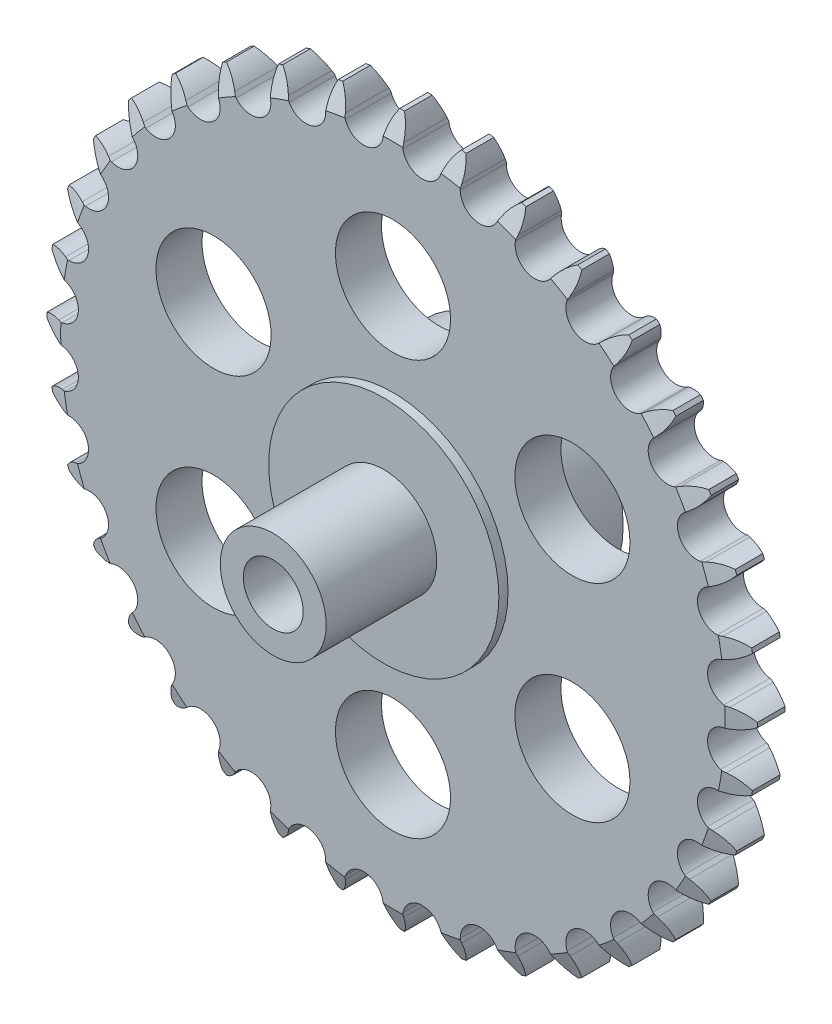
from build123d import *

# Parameters (mm, degrees)
SKETCH2_R                       = 68.60307911
BOSS_EXTRUDE1_DEPTH             = 5
BOSS_EXTRUDE2_REACH             = 99.148
BOSS_EXTRUDE2_DIRECTION_2_REACH = 99.148
CIRPATTERN1_COUNT               = 36
BOSS_EXTRUDE3_DEPTH             = 7
BOSS_EXTRUDE3_DEPTH_BACK        = 20
SKETCH6_R                       = 25
CUT_EXTRUDE1_DEPTH              = 111.942596201
CUT_EXTRUDE1_DEPTH_BACK         = 111.942596201
SKETCH7_R                       = 6.5
SKETCH8_R                       = 11.5
SKETCH8_R_2                     = 6.5
BOSS_EXTRUDE4_DEPTH             = 24
SKETCH9_R                       = 12.5
CUT_EXTRUDE2_DEPTH              = 113.179586609
CIRPATTERN2_COUNT               = 6


with BuildPart() as part:
    # Sketch2 → Boss-Extrude1 (new, symmetric)
    with BuildSketch(Plane.XY):
        Circle(SKETCH2_R)
    extrude(amount=BOSS_EXTRUDE1_DEPTH, both=True)

    # Boss-Extrude2: up to this face of the body (flat: up to its plane)
    boss_extrude2_end = Plane(part.part.faces().sort_by_distance((0, 0, 5))[0])
    # Sketch4 → Boss-Extrude2 (add, up to the picked face)
    with BuildSketch(Plane.XY, mode=Mode.PRIVATE) as boss_extrude2_sk1:
        with BuildLine():
            Line((-0.5, 77.163008044), (0.5, 77.163008044))
            ThreePointArc((0.5, 77.163008044), (1.520836, 75.099924668), (2.042896963, 72.85807911))
            Line((2.042896963, 72.85807911), (2.156832572, 71.85807911))
            ThreePointArc((2.156832572, 71.85807911), (3.469336894, 69.449250243), (5.979152315, 68.342023682))
            ThreePointArc((5.979152315, 68.342023682), (0, 68.60307911), (-5.979152315, 68.342023682))
            ThreePointArc((-5.979152315, 68.342023682), (-3.469336894, 69.449250243), (-2.156832572, 71.85807911))
            Line((-2.156832572, 71.85807911), (-2.042896963, 72.85807911))
            ThreePointArc((-2.042896963, 72.85807911), (-1.520836, 75.099924668), (-0.5, 77.163008044))
        make_face()
    boss_extrude2_tool1 = split(extrude(boss_extrude2_sk1.sketch, amount=BOSS_EXTRUDE2_REACH, mode=Mode.PRIVATE), bisect_by=boss_extrude2_end, keep=Keep.BOTH, mode=Mode.PRIVATE)
    boss_extrude2 = boss_extrude2_tool1.solids().sort_by(Axis((0, 71.819777, 0), (0, 0, 1)))[0]
    add(boss_extrude2)

    # Boss-Extrude2 direction 2: up to this face of the body (flat: up to its plane)
    boss_extrude2_direction_2_end = Plane(part.part.faces().sort_by_distance((0, 0, -5))[0])
    # Sketch4 → Boss-Extrude2 direction 2 (add, up to the picked face)
    with BuildSketch(Plane.XY, mode=Mode.PRIVATE) as boss_extrude2_direction_2_sk1:
        with BuildLine():
            Line((-0.5, 77.163008044), (0.5, 77.163008044))
            ThreePointArc((0.5, 77.163008044), (1.520836, 75.099924668), (2.042896963, 72.85807911))
            Line((2.042896963, 72.85807911), (2.156832572, 71.85807911))
            ThreePointArc((2.156832572, 71.85807911), (3.469336894, 69.449250243), (5.979152315, 68.342023682))
            ThreePointArc((5.979152315, 68.342023682), (0, 68.60307911), (-5.979152315, 68.342023682))
            ThreePointArc((-5.979152315, 68.342023682), (-3.469336894, 69.449250243), (-2.156832572, 71.85807911))
            Line((-2.156832572, 71.85807911), (-2.042896963, 72.85807911))
            ThreePointArc((-2.042896963, 72.85807911), (-1.520836, 75.099924668), (-0.5, 77.163008044))
        make_face()
    boss_extrude2_direction_2_tool1 = split(extrude(boss_extrude2_direction_2_sk1.sketch, amount=-BOSS_EXTRUDE2_DIRECTION_2_REACH, mode=Mode.PRIVATE), bisect_by=boss_extrude2_direction_2_end, keep=Keep.BOTH, mode=Mode.PRIVATE)
    boss_extrude2_direction_2 = boss_extrude2_direction_2_tool1.solids().sort_by(Axis((0, 71.819777, 0), (0, 0, -1)))[0]
    add(boss_extrude2_direction_2)

    # CirPattern1: Boss-Extrude2, Boss-Extrude2 direction 2 ×36 about axis
    cirpattern1_axis = Axis((0, 0, 5), (0, 0, -1))
    add([boss_extrude2.rotate(cirpattern1_axis, i * 360 / CIRPATTERN1_COUNT) for i in range(1, CIRPATTERN1_COUNT)])
    add([boss_extrude2_direction_2.rotate(cirpattern1_axis, i * 360 / CIRPATTERN1_COUNT) for i in range(1, CIRPATTERN1_COUNT)])

    # Sketch5 → Cut-Revolve7 (revolve, cut)
    with BuildSketch(Plane(origin=(0, 0, 0), x_dir=(0, 0, -1), z_dir=(1, 0, 0))):
        Polygon((6, 84.663008044), (0, 84.663008044), (6, 69.663008044), align=None)
        Polygon((0, 84.663008044), (-6, 84.663008044), (-6, 69.663008044), align=None)
    revolve(axis=Axis((0, 0, 0), (0, 0, 1)), mode=Mode.SUBTRACT)

    # Sketch6 → Boss-Extrude3 (add, two sides: drawn at the far end of the back side and taken through both)
    with BuildSketch(Plane.XY.offset(-BOSS_EXTRUDE3_DEPTH_BACK)):
        Circle(SKETCH6_R)
    extrude(amount=BOSS_EXTRUDE3_DEPTH + BOSS_EXTRUDE3_DEPTH_BACK)

    # Sketch7 → Cut-Extrude1 (cut, two sides: drawn at the far end of the back side and taken through both)
    with BuildSketch(Plane.XY.offset(-CUT_EXTRUDE1_DEPTH_BACK)):
        Circle(SKETCH7_R)
    extrude(amount=CUT_EXTRUDE1_DEPTH + CUT_EXTRUDE1_DEPTH_BACK, mode=Mode.SUBTRACT)

    # Sketch8 → Boss-Extrude4 (add)
    with BuildSketch(Plane.XY.offset(7)):
        Circle(SKETCH8_R)
        Circle(SKETCH8_R_2, mode=Mode.SUBTRACT)
    extrude(amount=BOSS_EXTRUDE4_DEPTH)

    # Sketch9 → Cut-Extrude2 (cut, through all)
    with BuildSketch(Plane.XY.offset(5)):
        with Locations((0, 45)):
            Circle(SKETCH9_R)
    cut_extrude2 = extrude(amount=-CUT_EXTRUDE2_DEPTH, mode=Mode.SUBTRACT)

    # CirPattern2: Cut-Extrude2 ×6 about axis
    cirpattern2_axis = Axis((0, 0, -20), (0, 0, 1))
    for i in range(1, CIRPATTERN2_COUNT):
        add(cut_extrude2.rotate(cirpattern2_axis, i * 360 / CIRPATTERN2_COUNT), mode=Mode.SUBTRACT)


solid = part.part
